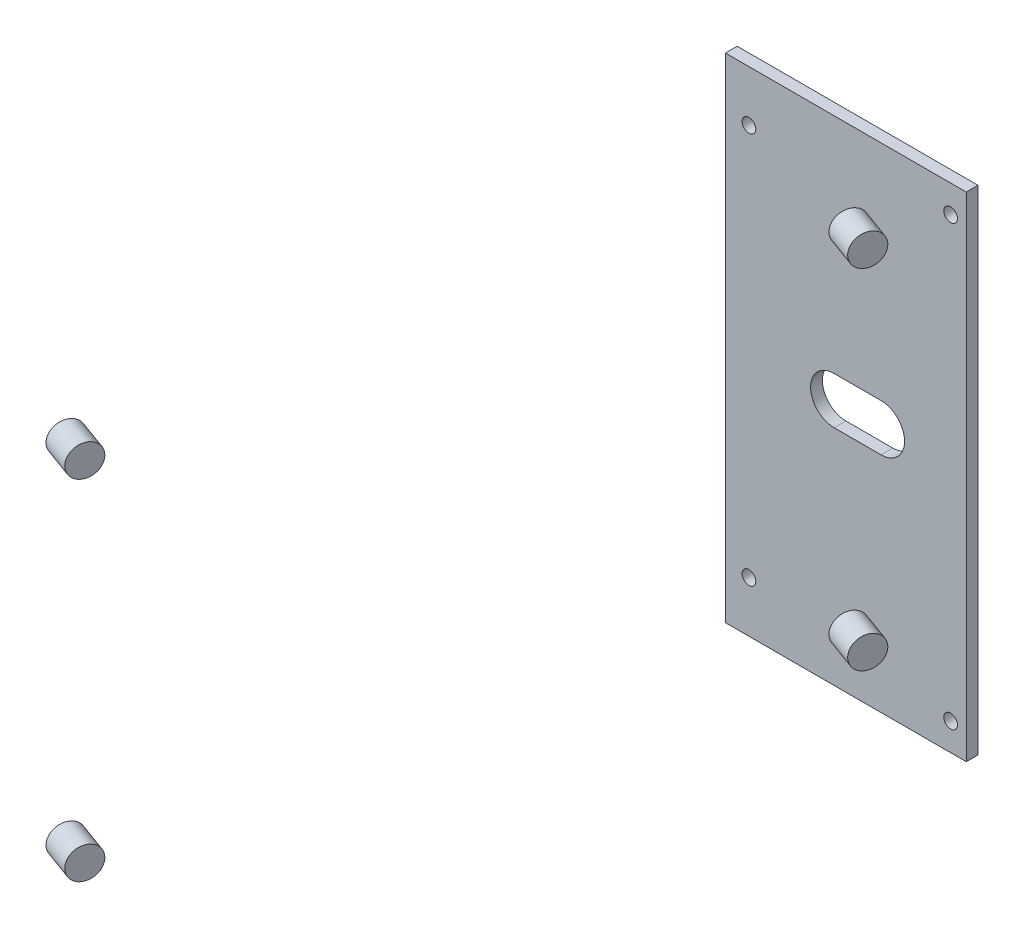
from build123d import *

# Parameters (mm, degrees)
SKETCH1_W             = 61.5
SKETCH1_H             = 126
SKETCH1_R             = 1.75
BOSS_EXTRUDE1_DEPTH   = 3
CUT_EXTRUDE1_REACH    = 90.092
SKETCH3_R             = 4
BOSS_EXTRUDE2_DEPTH   = 8
BOSS_EXTRUDE2_2_DEPTH = 8
BOSS_EXTRUDE2_3_DEPTH = 8
BOSS_EXTRUDE2_4_DEPTH = 8


with BuildPart() as part:
    # Sketch1 → Boss-Extrude1 (new body)
    with BuildSketch(Plane.XY):
        with Locations((-30.75, 0)):
            Rectangle(SKETCH1_W, SKETCH1_H)
        with Locations((-4, 56)):
            Circle(SKETCH1_R, mode=Mode.SUBTRACT)
        with Locations((-55.5, 50)):
            Circle(SKETCH1_R, mode=Mode.SUBTRACT)
        with Locations((-4, -56)):
            Circle(SKETCH1_R, mode=Mode.SUBTRACT)
        with Locations((-55.5, -50)):
            Circle(SKETCH1_R, mode=Mode.SUBTRACT)
    extrude(amount=BOSS_EXTRUDE1_DEPTH)

    # Sketch2 → Cut-Extrude1 (cut, up to next)
    with BuildSketch(Plane.XY.offset(3), mode=Mode.PRIVATE) as cut_extrude1_sk1:
        with BuildLine():
            Line((-33.75, 6), (-21.75, 6))
            ThreePointArc((-21.75, 6), (-15.75, 0), (-21.75, -6))
            Line((-21.75, -6), (-33.75, -6))
            ThreePointArc((-33.75, -6), (-39.75, 0), (-33.75, 6))
        make_face()
    cut_extrude1_tool1 = extrude(cut_extrude1_sk1.sketch, amount=-CUT_EXTRUDE1_REACH, mode=Mode.PRIVATE) & part.part
    add(cut_extrude1_tool1.solids().sort_by_distance((-27.75, 0, 3))[0], mode=Mode.SUBTRACT)


with BuildPart() as body_2:
    # Sketch3 → Boss-Extrude2 (new body)
    with BuildSketch(Plane(origin=(-13.018158624, 0, -4.738222244), x_dir=(-0.34202014332566627, 0, 0.9396926207859093), z_dir=(-0.9396926207859093, 0, -0.34202014332566627))):
        with Locations((171.511529542, 44.5)):
            Circle(SKETCH3_R)
    extrude(amount=BOSS_EXTRUDE2_DEPTH)


with BuildPart() as body_3:
    # Sketch3 → Boss-Extrude2 2 (new body)
    with BuildSketch(Plane(origin=(-13.018158624, 0, -4.738222244), x_dir=(-0.34202014332566627, 0, 0.9396926207859093), z_dir=(-0.9396926207859093, 0, -0.34202014332566627))):
        with Locations((171.511529542, -44.5)):
            Circle(SKETCH3_R)
    extrude(amount=BOSS_EXTRUDE2_2_DEPTH)


with BuildPart() as body_4:
    # Sketch3 → Boss-Extrude2 3 (new body)
    with BuildSketch(Plane(origin=(-13.018158624, 0, -4.738222244), x_dir=(-0.34202014332566627, 0, 0.9396926207859093), z_dir=(-0.9396926207859093, 0, -0.34202014332566627))):
        with Locations((15.511529542, -44.5)):
            Circle(SKETCH3_R)
    extrude(amount=BOSS_EXTRUDE2_3_DEPTH)


with BuildPart() as body_5:
    # Sketch3 → Boss-Extrude2 4 (new body)
    with BuildSketch(Plane(origin=(-13.018158624, 0, -4.738222244), x_dir=(-0.34202014332566627, 0, 0.9396926207859093), z_dir=(-0.9396926207859093, 0, -0.34202014332566627))):
        with Locations((15.511529542, 44.5)):
            Circle(SKETCH3_R)
    extrude(amount=BOSS_EXTRUDE2_4_DEPTH)


solid = Compound([part.part, body_2.part, body_3.part, body_4.part, body_5.part])
